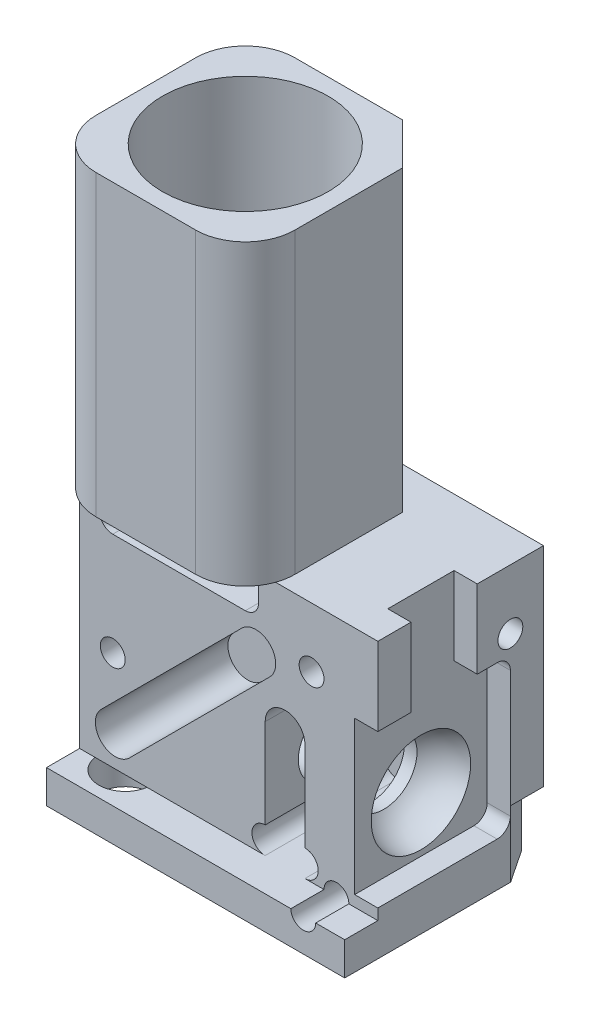
from build123d import *

# Parameters (mm, degrees)
SKETCH1_W                   = 9
SKETCH1_H                   = 6
MAIN_BODY_EXT_DEPTH         = 8.3
EMISSION_PATH_EXT_DEPTH     = 9
SKETCH3_R                   = 1.25
EMISSION_AND_GRIN_CUT_DEPTH = 19.125672401
SKETCH4_R                   = 1
DRUM_LENS_CUT_DEPTH         = 7
SKETCH5_W                   = 9
SKETCH5_H                   = 7.3
FILTERSET_CUT1_DEPTH        = 1
FILTERSET_CUT2_DEPTH        = 4
SKETCH10_R                  = 2.5
EMISSION_LENS_CUT_DEPTH     = 8.5
SKETCH15_R                  = 0.795
MAGNETS_CUT_DEPTH           = 1
SCREW_HOLES_CUT_DEPTH       = 19.561788707
SCREW_HOLES_CUT_DEPTH_BACK  = 3
SKETCH18_R                  = 0.375
EXTERNAL_FILLET_1_R         = 1.5
CUT_EXTRUDE8_DEPTH          = 12.545128843
CUT_EXTRUDE8_DEPTH_BACK     = 4
SKETCH28_R                  = 1.5
CUT_EXTRUDE9_DEPTH          = 2
CUT_EXTRUDE10_DEPTH         = 0.7
SKETCH29_R                  = 0.375
CUT_EXTRUDE11_DEPTH         = 2.5
SKETCH32_W                  = 2
SKETCH32_H                  = 2.36
CUT_EXTRUDE14_DEPTH         = 0.7
CUT_EXTRUDE16_DEPTH         = 9


with BuildPart() as part:
    # Sketch1 → Main Body Ext (new body)
    with BuildSketch(Plane(origin=(0, 0, 0), x_dir=(1, 0, 0), z_dir=(0, 1, 0))):
        Rectangle(SKETCH1_W, SKETCH1_H)
    extrude(amount=MAIN_BODY_EXT_DEPTH)

    # Sketch8 → Emission Path Ext (add)
    with BuildSketch(Plane(origin=(0, 8.3, 0), x_dir=(1, 0, 0), z_dir=(0, 1, 0))):
        Polygon((0.25, 3), (1.5, 1.75), (1.5, -3), (-4.5, -3), (-4.5, 3), align=None)
    extrude(amount=EMISSION_PATH_EXT_DEPTH)

    # Sketch3 → Emission and Grin Cut (cut, through all)
    with BuildSketch(Plane.XZ):
        with Locations(Location((-1.5, 0, 0), (0, 0, 270))):
            Circle(SKETCH3_R)
    extrude(amount=-EMISSION_AND_GRIN_CUT_DEPTH, mode=Mode.SUBTRACT)

    # Sketch4 → Drum Lens Cut (cut)
    with BuildSketch(Plane(origin=(4.5, 0, 0), x_dir=(0, 0, -1), z_dir=(1, 0, 0))):
        with Locations((0, 3)):
            Circle(SKETCH4_R)
    extrude(amount=-DRUM_LENS_CUT_DEPTH, mode=Mode.SUBTRACT)

    # Sketch5 → FilterSet Cut1 (cut)
    with BuildSketch(Plane.XY.offset(3)):
        with Locations((0, 4.65)):
            Rectangle(SKETCH5_W, SKETCH5_H)
    extrude(amount=-FILTERSET_CUT1_DEPTH, mode=Mode.SUBTRACT)

    # Sketch6 → FilterSet Cut2 (cut)
    with BuildSketch(Plane.XY.offset(2)):
        with BuildLine():
            Line((2.3, 4.5), (2.3, 1.8))
            ThreePointArc((2.3, 1.8), (2.7, 1.4), (2.3, 1))
            Line((2.3, 1), (1.1, 1))
            ThreePointArc((1.1, 1), (0.7, 1.4), (1.1, 1.8))
            Line((1.1, 1.8), (1.1, 4.5))
            ThreePointArc((1.1, 4.5), (1.7, 5.1), (2.3, 4.5))
        make_face()
        with BuildLine():
            Line((-3.9, 7.9), (-3.9, 7.5))
            ThreePointArc((-3.9, 7.5), (-3.782842712, 7.217157288), (-3.5, 7.1))
            Line((-3.5, 7.1), (0.5, 7.1))
            ThreePointArc((0.5, 7.1), (0.782842712, 7.217157288), (0.9, 7.5))
            Line((0.9, 7.5), (0.9, 7.9))
            ThreePointArc((0.9, 7.9), (0.782842712, 8.182842712), (0.5, 8.3))
            Line((0.5, 8.3), (-3.5, 8.3))
            ThreePointArc((-3.5, 8.3), (-3.782842712, 8.182842712), (-3.9, 7.9))
        make_face()
        with BuildLine():
            Line((0.39411255, 6.591168825), (-3.848528137, 2.348528137))
            ThreePointArc((-3.848528137, 2.348528137), (-3.848528137, 1.5), (-3, 1.5))
            Line((-3, 1.5), (1.242640687, 5.742640687))
            ThreePointArc((1.242640687, 5.742640687), (1.242640687, 6.591168825), (0.39411255, 6.591168825))
        make_face()
    extrude(amount=-FILTERSET_CUT2_DEPTH, mode=Mode.SUBTRACT)

    # Sketch10 → Emission Lens Cut (cut)
    with BuildSketch(Plane(origin=(0, 17.3, 0), x_dir=(1, 0, 0), z_dir=(0, 1, 0))):
        with Locations(Location((-1.5, 0, 0), (0, 0, 270))):
            Circle(SKETCH10_R)
    extrude(amount=-EMISSION_LENS_CUT_DEPTH, mode=Mode.SUBTRACT)

    # Sketch15 → Magnets Cut (cut)
    with BuildSketch(Plane.XZ):
        with Locations(Location((-3.25, -1.875, 0), (0, 0, 270))):
            Circle(SKETCH15_R)
        with Locations(Location((-3.25, 1.875, 0), (0, 0, 270))):
            Circle(SKETCH15_R)
        with Locations(Location((1.5, 0, 0), (0, 0, 270))):
            Circle(SKETCH15_R)
    extrude(amount=-MAGNETS_CUT_DEPTH, mode=Mode.SUBTRACT)

    # Sketch18 → Screw Holes Cut (cut, two sides: drawn at the far end of the back side and taken through both)
    with BuildSketch(Plane.XY.offset(2).offset(-SCREW_HOLES_CUT_DEPTH_BACK)):
        with Locations(Location((-3.5, 4, 0), (0, 0, 180))):
            Circle(SKETCH18_R)
        with Locations(Location((2.5, 6.5, 0), (0, 0, 180))):
            Circle(SKETCH18_R)
        with Locations((3.25, 1)):
            Circle(SKETCH18_R)
    extrude(amount=SCREW_HOLES_CUT_DEPTH + SCREW_HOLES_CUT_DEPTH_BACK, mode=Mode.SUBTRACT)

    # External Fillet 1
    # the kernel refuses this fillet: 1.5 mm, written as the material it takes off along each edge
    with BuildSketch(Plane(origin=(-4.5, -3.75, -3), x_dir=(1, 0, 0), z_dir=(0, 1, 0))) as external_fillet_1_piece_1:
        with BuildLine():
            CenterArc((EXTERNAL_FILLET_1_R, -EXTERNAL_FILLET_1_R), EXTERNAL_FILLET_1_R, 90, 90)
            Line((0, -EXTERNAL_FILLET_1_R), (0, 0))
            Line((0, 0), (EXTERNAL_FILLET_1_R, 0))
        make_face()
    extrude(amount=24.8, mode=Mode.SUBTRACT)
    with BuildSketch(Plane(origin=(1.5, 8.3, 3), x_dir=(0, 0, -1), z_dir=(0, 1, 0))) as external_fillet_1_piece_2:
        with BuildLine():
            CenterArc((EXTERNAL_FILLET_1_R, EXTERNAL_FILLET_1_R), EXTERNAL_FILLET_1_R, 180, 90)
            Line((0, EXTERNAL_FILLET_1_R), (0, 0))
            Line((0, 0), (EXTERNAL_FILLET_1_R, 0))
        make_face()
    extrude(amount=12.75, mode=Mode.SUBTRACT)

    # Sketch28 → Cut-Extrude8 (cut, two sides: drawn at the far end of the back side and taken through both)
    with BuildSketch(Plane(origin=(0, 7.1, 0), x_dir=(1, 0, 0), z_dir=(0, 1, 0)).offset(-CUT_EXTRUDE8_DEPTH_BACK)):
        with Locations(Location((-1.5, 0, 0), (0, 0, 180))):
            Circle(SKETCH28_R)
    extrude(amount=CUT_EXTRUDE8_DEPTH + CUT_EXTRUDE8_DEPTH_BACK, mode=Mode.SUBTRACT)

    # Sketch14 → Cut-Extrude9 (cut)
    with BuildSketch(Plane.XZ):
        Polygon((4.5, -3), (4.5, -2.006698359), (3.837798906, -3), align=None)
    extrude(amount=-CUT_EXTRUDE9_DEPTH, mode=Mode.SUBTRACT)

    # Sketch12 → Cut-Extrude10 (cut)
    with BuildSketch(Plane(origin=(4.5, 0, 0), x_dir=(0, 0, -1), z_dir=(1, 0, 0))):
        with BuildLine():
            Line((1.6, 5.94), (-1.6, 5.94))
            Line((-1.6, 5.94), (-2, 5.94))
            Line((-2, 5.94), (-2, 1.33))
            Line((-2, 1.33), (1.6, 1.33))
            ThreePointArc((1.6, 1.33), (1.882842712, 1.447157288), (2, 1.73))
            Line((2, 1.73), (2, 5.54))
            ThreePointArc((2, 5.54), (1.882842712, 5.822842712), (1.6, 5.94))
        make_face()
    extrude(amount=-CUT_EXTRUDE10_DEPTH, mode=Mode.SUBTRACT)

    # Sketch29 → Cut-Extrude11 (cut)
    with BuildSketch(Plane(origin=(4.5, 0, 0), x_dir=(0, 0, -1), z_dir=(1, 0, 0))):
        with Locations((2, 6.5)):
            Circle(SKETCH29_R)
    extrude(amount=-CUT_EXTRUDE11_DEPTH, mode=Mode.SUBTRACT)

    # Sketch32 → Cut-Extrude14 (cut)
    with BuildSketch(Plane(origin=(4.5, 0, 0), x_dir=(0, 0, -1), z_dir=(1, 0, 0))):
        with Locations((0, 7.12)):
            Rectangle(SKETCH32_W, SKETCH32_H)
    extrude(amount=-CUT_EXTRUDE14_DEPTH, mode=Mode.SUBTRACT)

    # Sketch33 → Cut-Revolve1 (revolve, cut)
    with BuildSketch(Plane.XY, mode=Mode.PRIVATE) as cut_revolve1_sk:
        with BuildLine():
            Line((3.8, 3), (2.3, 3))
            ThreePointArc((2.3, 3), (2.739339828, 4.060660172), (3.8, 4.5))
            Line((3.8, 4.5), (3.8, 3))
        make_face()
    revolve(cut_revolve1_sk.sketch.rotate(Axis((3.8, 3, 0), (-1, 0, 0)), 90), axis=Axis((3.8, 3, 0), (-1, 0, 0)), mode=Mode.SUBTRACT)

    # Sketch36 → Cut-Extrude16 (cut)
    with BuildSketch(Plane(origin=(0, 17.3, 0), x_dir=(1, 0, 0), z_dir=(0, 1, 0))):
        with BuildLine():
            Line((-4.5, -1.5), (-4.5, -3))
            Line((-4.5, -3), (-3, -3))
            ThreePointArc((-3, -3), (-4.060660172, -2.560660172), (-4.5, -1.5))
        make_face()
    extrude(amount=-CUT_EXTRUDE16_DEPTH, mode=Mode.SUBTRACT)


solid = part.part
